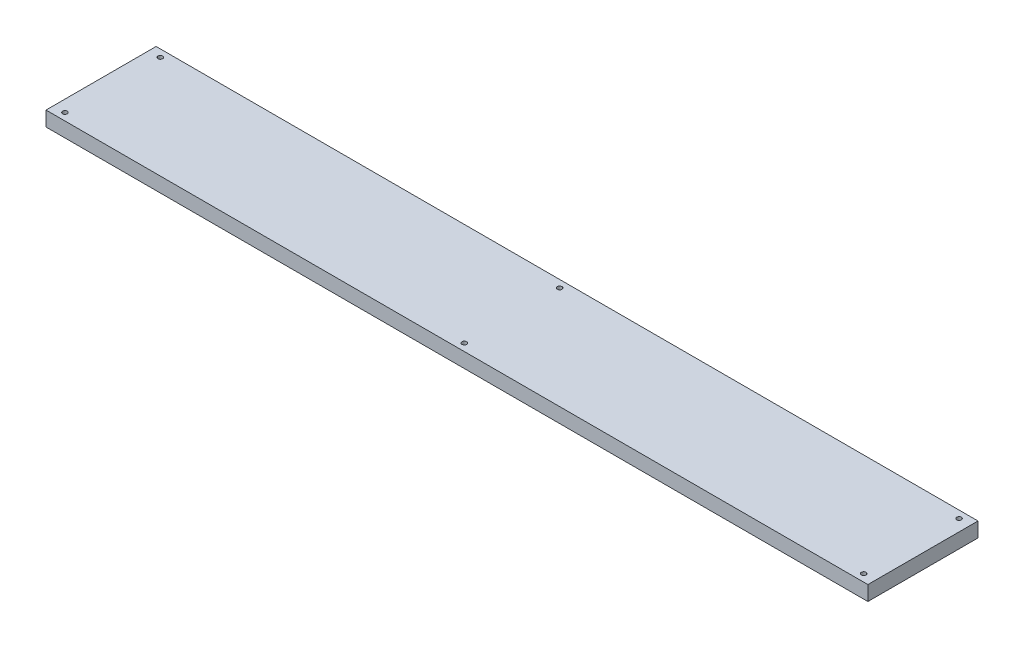
from build123d import *

# Parameters (mm, degrees)
SKETCH1_W           = 709
SKETCH1_H           = 95
BOSS_EXTRUDE1_DEPTH = 12.7
SKETCH2_R           = 2.0195
CUT_EXTRUDE1_DEPTH  = 716.449012858


with BuildPart() as part:
    # Sketch1 → Boss-Extrude1 (new body)
    with BuildSketch(Plane(origin=(0, 0, 0), x_dir=(1, 0, 0), z_dir=(0, 1, 0))):
        with Locations((354.5, 47.5)):
            Rectangle(SKETCH1_W, SKETCH1_H)
    extrude(amount=BOSS_EXTRUDE1_DEPTH)

    # Sketch2 → Cut-Extrude1 (cut, through all)
    with BuildSketch(Plane.XZ):
        with Locations((10, -88.65)):
            Circle(SKETCH2_R)
        with Locations((354.5, -88.65)):
            Circle(SKETCH2_R)
        with Locations((699, -88.65)):
            Circle(SKETCH2_R)
        with Locations((699, -6.35)):
            Circle(SKETCH2_R)
        with Locations((354.5, -6.35)):
            Circle(SKETCH2_R)
        with Locations((10, -6.35)):
            Circle(SKETCH2_R)
    extrude(amount=-CUT_EXTRUDE1_DEPTH, mode=Mode.SUBTRACT)


solid = part.part
